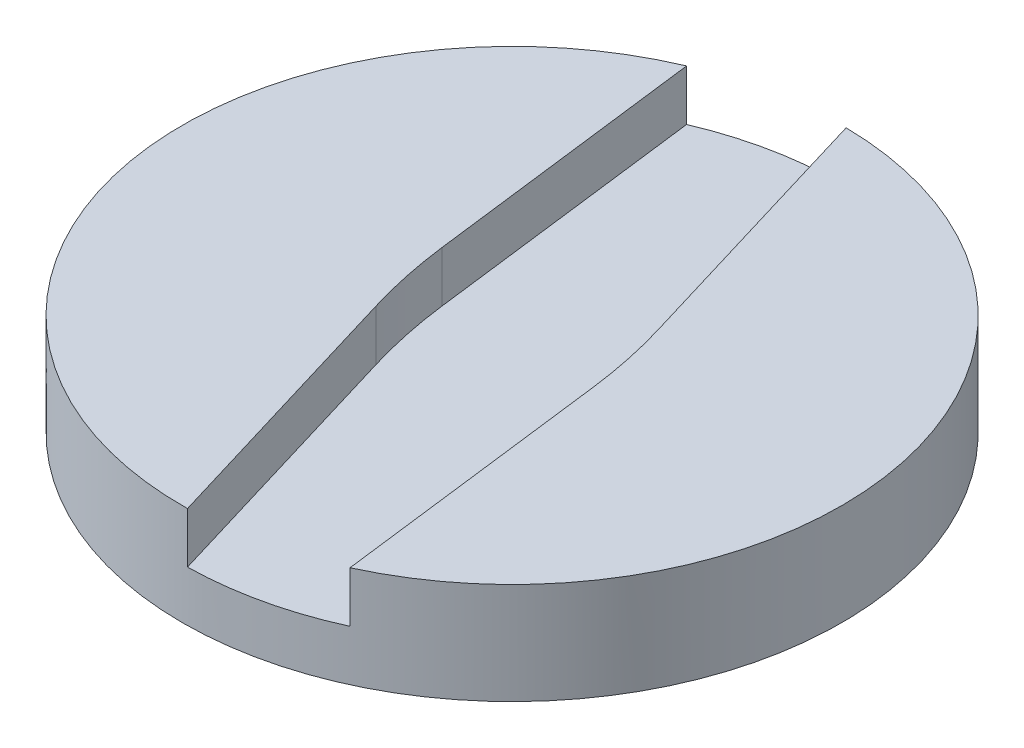
from build123d import *

# Parameters (mm, degrees)
CROQUIS1_R              = 13
SALIENTE_EXTRUIR1_DEPTH = 4
CORTAR_EXTRUIR1_DEPTH   = 2


with BuildPart() as part:
    # Croquis1 → Saliente-Extruir1 (new body)
    with BuildSketch(Plane(origin=(0, 0, 0), x_dir=(1, 0, 0), z_dir=(0, 1, 0))):
        Circle(CROQUIS1_R)
    extrude(amount=SALIENTE_EXTRUIR1_DEPTH)

    # Croquis4 → Cortar-Extruir1 (cut)
    with BuildSketch(Plane(origin=(0, 4, 0), x_dir=(1, 0, 0), z_dir=(0, 1, 0))):
        with BuildLine():
            Line((-3.008569809, -2.350062872), (0.832106592, -15.114323987))
            ThreePointArc((0.832106592, -15.114323987), (3.743141127, -16.839939118), (5.706770741, -14.08384979))
            Line((5.706770741, -14.08384979), (4.053140286, -0.857260534))
            ThreePointArc((4.053140286, -0.857260534), (3.931546007, -0.026685558), (3.775206096, 0.798055486))
            ThreePointArc((3.775206096, 0.798055486), (3.584395962, 1.615509737), (3.359451736, 2.424237166))
            Line((3.359451736, 2.424237166), (-0.481224665, 15.188498281))
            ThreePointArc((-0.481224665, 15.188498281), (-3.3922592, 16.914113412), (-5.355888815, 14.158024084))
            Line((-5.355888815, 14.158024084), (-3.702258359, 0.931434828))
            ThreePointArc((-3.702258359, 0.931434828), (-3.58066408, 0.100859852), (-3.42432417, -0.723881193))
            ThreePointArc((-3.42432417, -0.723881193), (-3.233514036, -1.541335443), (-3.008569809, -2.350062872))
        make_face()
    extrude(amount=-CORTAR_EXTRUIR1_DEPTH, mode=Mode.SUBTRACT)


solid = part.part
